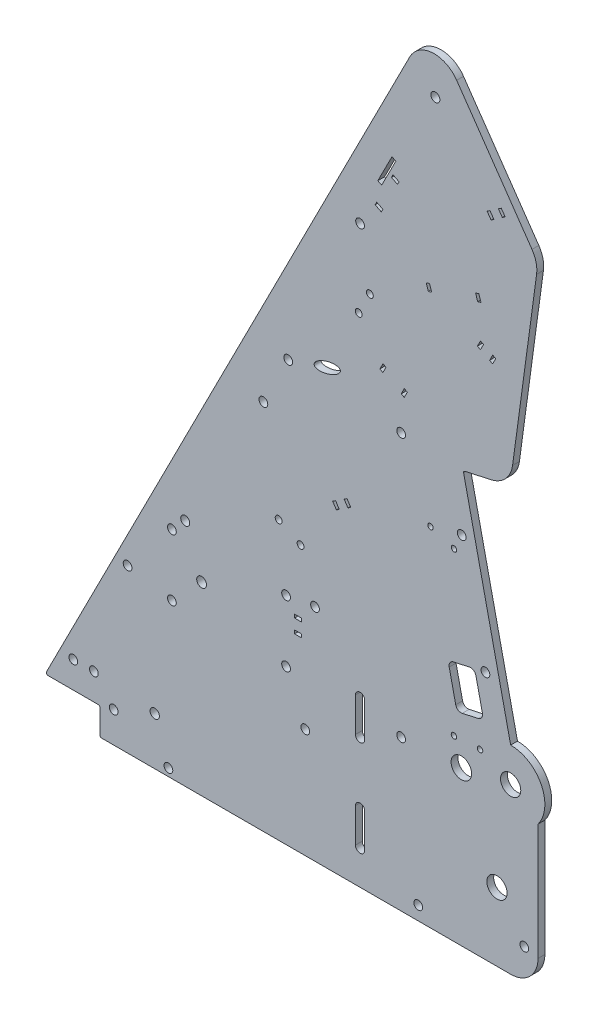
from build123d import *

# Parameters (mm, degrees)
BOSS_EXTRUDE1_DEPTH     = 3.175
SKETCH2_R               = 2.0955
SKETCH2_R_2             = 2.286
SKETCH2_R_3             = 2.032
SKETCH2_R_4             = 4.699
CUT_EXTRUDE1_DEPTH      = 421.976111717
SKETCH7_R               = 2.159
CUT_EXTRUDE2_DEPTH      = 421.976111717
CUT_EXTRUDE3_REACH      = 422.976
SKETCH10_R              = 2.032
FILLET1_R               = 12.7
FILLET2_R               = 0.79375
SKETCH12_R              = 2.032
CUT_EXTRUDE5_DEPTH      = 411.989226146
SKETCH13_R              = 2.032
SKETCH13_R_2            = 1.6
SKETCH13_RX             = 6.35
SKETCH13_RY             = 2.38125
SKETCH13_W              = 3.175
SKETCH13_H              = 1.5875
CUT_EXTRUDE6_DEPTH      = 411.989226146
CUT_EXTRUDE7_DEPTH      = 411.989226285
CUT_EXTRUDE7_DEPTH_BACK = 411.989226285
SKETCH14_R              = 1.27
SKETCH14_R_2            = 2.032
FILLET3_R               = 2.54
SKETCH15_R              = 4.7625
CUT_EXTRUDE8_DEPTH      = 411.989226285


with BuildPart() as part:
    # Sketch1 → Boss-Extrude1 (new body)
    with BuildSketch(Plane.XY):
        with BuildLine():
            Line((228.6, -12.7), (228.6, 53.975))
            ThreePointArc((228.6, 53.975), (230.099031657, 70.599515829), (215.9, 79.375))
            Line((215.9, 79.375), (193.909735224, 178.566674323))
            Line((193.909735224, 178.566674323), (215.607913982, 183.377044743))
            Line((215.607913982, 183.377044743), (228.6, 279.4))
            Line((228.6, 279.4), (178.754725958, 351.413083686))
            Line((178.754725958, 351.413083686), (0, 0))
            Line((0, 0), (25.4, 0))
            Line((25.4, 0), (25.4, -12.7))
            Line((25.4, -12.7), (228.6, -12.7))
        make_face()
    extrude(amount=BOSS_EXTRUDE1_DEPTH)

    # Sketch2 → Cut-Extrude1 (cut, through all)
    with BuildSketch(Plane.XY.offset(3.175)):
        with Locations((64.943150167, 94.057839899)):
            Circle(SKETCH2_R)
        with Locations((180.975, 322.164313376)):
            Circle(SKETCH2_R)
        with Locations((72.544547852, 73.173171402)):
            Circle(SKETCH2_R_2)
        with Locations((193.207821773, 152.394364194)):
            Circle(SKETCH2_R_3)
        with Locations((215.9, 63.5)):
            Circle(SKETCH2_R_4)
        with Locations((173.0375, -6.35)):
            Circle(SKETCH2_R_3)
        with Locations((204.202954161, 102.798527032)):
            Circle(SKETCH2_R_3)
        with Locations((209.55, 19.05)):
            Circle(SKETCH2_R_4)
        with Locations((165.1, 179.3875)):
            Circle(SKETCH2_R_3)
        with Locations((111.724047852, 87.460671402)):
            Circle(SKETCH2_R_3)
        with Locations((111.724047852, 58.885671402)):
            Circle(SKETCH2_R_3)
        with Locations((58.765047852, 58.885671402)):
            Circle(SKETCH2_R_3)
        with Locations((58.765047852, 87.460671402)):
            Circle(SKETCH2_R_3)
    extrude(amount=-CUT_EXTRUDE1_DEPTH, mode=Mode.SUBTRACT)

    # Sketch7 → Cut-Extrude2 (cut, through all)
    with BuildSketch(Plane.XY.offset(3.175)):
        with Locations((50.8, 9.525)):
            Circle(SKETCH7_R)
        with BuildLine():
            Line((143.891, 3.175), (143.891, 19.05))
            ThreePointArc((143.891, 19.05), (146.05, 21.209), (148.209, 19.05))
            Line((148.209, 19.05), (148.209, 3.175))
            ThreePointArc((148.209, 3.175), (146.05, 1.016), (143.891, 3.175))
        make_face()
        with BuildLine():
            Line((143.891, 47.625), (143.891, 63.5))
            ThreePointArc((143.891, 63.5), (146.05, 65.659), (148.209, 63.5))
            Line((148.209, 63.5), (148.209, 47.625))
            ThreePointArc((148.209, 47.625), (146.05, 45.466), (143.891, 47.625))
        make_face()
    extrude(amount=-CUT_EXTRUDE2_DEPTH, mode=Mode.SUBTRACT)

    # Sketch10 → Cut-Extrude3 (cut, up to next)
    with BuildSketch(Plane.XY.offset(3.175), mode=Mode.PRIVATE) as cut_extrude3_sk1:
        with Locations((120.65, 38.1)):
            Circle(SKETCH10_R)
    cut_extrude3_tool1 = extrude(cut_extrude3_sk1.sketch, amount=-CUT_EXTRUDE3_REACH, mode=Mode.PRIVATE) & part.part
    # Sketch10 → Cut-Extrude3 (cut, up to next)
    with BuildSketch(Plane.XY.offset(3.175), mode=Mode.PRIVATE) as cut_extrude3_sk2:
        with Locations((165.1, 57.15)):
            Circle(SKETCH10_R)
    cut_extrude3_tool2 = extrude(cut_extrude3_sk2.sketch, amount=-CUT_EXTRUDE3_REACH, mode=Mode.PRIVATE) & part.part
    # Sketch10 → Cut-Extrude3 (cut, up to next)
    with BuildSketch(Plane.XY.offset(3.175), mode=Mode.PRIVATE) as cut_extrude3_sk3:
        with Locations((13.046467246, 12.334704411)):
            Circle(SKETCH10_R)
    cut_extrude3_tool3 = extrude(cut_extrude3_sk3.sketch, amount=-CUT_EXTRUDE3_REACH, mode=Mode.PRIVATE) & part.part
    # Sketch10 → Cut-Extrude3 (cut, up to next)
    with BuildSketch(Plane.XY.offset(3.175), mode=Mode.PRIVATE) as cut_extrude3_sk4:
        with Locations((22.571467246, 12.334704411)):
            Circle(SKETCH10_R)
    cut_extrude3_tool4 = extrude(cut_extrude3_sk4.sketch, amount=-CUT_EXTRUDE3_REACH, mode=Mode.PRIVATE) & part.part
    # Sketch10 → Cut-Extrude3 (cut, up to next)
    with BuildSketch(Plane.XY.offset(3.175), mode=Mode.PRIVATE) as cut_extrude3_sk5:
        with Locations((38.211447917, 62.639810909)):
            Circle(SKETCH10_R)
    cut_extrude3_tool5 = extrude(cut_extrude3_sk5.sketch, amount=-CUT_EXTRUDE3_REACH, mode=Mode.PRIVATE) & part.part
    add(cut_extrude3_tool1.solids().sort_by_distance((120.65, 38.1, 3.175))[0], mode=Mode.SUBTRACT)
    add(cut_extrude3_tool2.solids().sort_by_distance((165.1, 57.15, 3.175))[0], mode=Mode.SUBTRACT)
    add(cut_extrude3_tool3.solids().sort_by_distance((13.046467, 12.334704, 3.175))[0], mode=Mode.SUBTRACT)
    add(cut_extrude3_tool4.solids().sort_by_distance((22.571467, 12.334704, 3.175))[0], mode=Mode.SUBTRACT)
    add(cut_extrude3_tool5.solids().sort_by_distance((38.211448, 62.639811, 3.175))[0], mode=Mode.SUBTRACT)

    # Fillet1
    fillet1_edges = [part.edges().sort_by_distance(p)[0] for p in [
        (228.6, -12.7, 1.5875),
        (178.754725958, 351.413083686, 1.5875),
        (215.607913982, 183.377044743, 1.5875),
        (228.6, 279.4, 1.5875),
    ]]
    fillet(fillet1_edges, radius=FILLET1_R)

    # Fillet2
    fillet2_edges = [part.edges().sort_by_distance(p)[0] for p in [
        (25.4, -12.7, 1.5875),
        (25.4, 0, 1.5875),
        (193.909735224, 178.566674323, 1.5875),
        (0, 0, 1.5875),
    ]]
    fillet(fillet2_edges, radius=FILLET2_R)

    # Sketch12 → Cut-Extrude5 (cut, through all)
    with BuildSketch(Plane.XY.offset(3.175)):
        with Locations((31.75, 1.5875)):
            Circle(SKETCH12_R)
        with Locations((173.0375, -6.35)):
            Circle(SKETCH12_R)
        with Locations((222.25, 1.5875)):
            Circle(SKETCH12_R)
        with Locations((57.15, -9.2075)):
            Circle(SKETCH12_R)
    extrude(amount=-CUT_EXTRUDE5_DEPTH, mode=Mode.SUBTRACT)

    # Sketch13 → Cut-Extrude6 (cut, through all)
    with BuildSketch(Plane.XY.offset(3.175)):
        with Locations((112.7125, 182.5625)):
            Circle(SKETCH13_R)
        with Locations((146.05, 254)):
            Circle(SKETCH13_R)
        with Locations((101.196445848, 159.923142748)):
            Circle(SKETCH13_R)
        with Locations((145.425401324, 217.737567137)):
            Circle(SKETCH13_R_2)
        with Locations((150.594024053, 227.898538502)):
            Circle(SKETCH13_R_2)
        with Locations((108.294003262, 116.150198589)):
            Circle(SKETCH13_R_2)
        with Locations((118.454974627, 110.981575859)):
            Circle(SKETCH13_R_2)
        with Locations(Location((130.826142263, 188.461522288), (0, 0, 18.038739462))):
            Ellipse(SKETCH13_RX, SKETCH13_RY)
        Polygon((178.26972852, 245.992253978), (176.758236028, 245.506922447), (177.728899089, 242.483937462), (179.240391581, 242.969268992), align=None)
        Polygon((160.847712251, 288.198438198), (154.283561384, 275.294004564), (156.066187939, 274.387228647), (162.630338806, 287.29166228), align=None)
        Polygon((200.609634347, 249.830809719), (202.12112684, 250.316141249), (201.150463779, 253.339126235), (199.638971286, 252.853794704), align=None)
        Polygon((160.590482388, 279.78010172), (163.420402045, 278.340594951), (164.140155429, 279.75555478), (161.310235773, 281.195061549), align=None)
        Polygon((153.789663007, 266.410402556), (153.069909623, 264.995442728), (155.899829279, 263.555935959), (156.619582664, 264.970895787), align=None)
        Polygon((203.330342332, 234.029927366), (201.915382504, 234.74968075), (200.475875735, 231.919761094), (201.890835563, 231.200007709), align=None)
        Polygon((206.135715047, 229.040747556), (207.550674876, 228.320994171), (208.990181645, 231.150913828), (207.575221816, 231.870667212), align=None)
        Polygon((211.540543439, 292.889033628), (210.235229039, 291.98553456), (212.042227175, 289.374905759), (213.347541575, 290.278404827), align=None)
        Polygon((206.319285837, 289.275037356), (205.013971437, 288.371538288), (206.820969573, 285.760909487), (208.126283974, 286.664408555), align=None)
        Polygon((133.35043444, 136.102010662), (135.081463368, 133.440401403), (136.412267998, 134.305915867), (134.681239069, 136.967525126), align=None)
        Polygon((155.228084113, 200.119678264), (156.643043941, 199.39992488), (158.08255071, 202.229844536), (156.667590882, 202.949597921), align=None)
        Polygon((165.132802911, 195.081404573), (166.547762739, 194.361651188), (167.987269508, 197.191570845), (166.57230968, 197.911324229), align=None)
        Polygon((140.404681887, 136.90245926), (138.673652958, 139.564068519), (140.004457588, 140.429582984), (141.735486516, 137.767973724), align=None)
        with Locations((117.248547852, 81.078921402)):
            Rectangle(SKETCH13_W, SKETCH13_H)
        with Locations((117.248547852, 74.728921402)):
            Rectangle(SKETCH13_W, SKETCH13_H)
    extrude(amount=-CUT_EXTRUDE6_DEPTH, mode=Mode.SUBTRACT)

    # Sketch14 → Cut-Extrude7 (cut, two sides: drawn at the far end of the back side and taken through both)
    with BuildSketch(Plane.XY.offset(3.175).offset(-CUT_EXTRUDE7_DEPTH_BACK)):
        with Locations((189.602197334, 69.980636704)):
            Circle(SKETCH14_R)
        with Locations((201.708862449, 70.509225118)):
            Circle(SKETCH14_R)
        with Locations((165.1, 57.15)):
            Circle(SKETCH14_R_2)
        with Locations((125.14977438, 89.522927623)):
            Circle(SKETCH14_R_2)
        with Locations((178.721644858, 148.532438598)):
            Circle(SKETCH14_R)
        with Locations((189.622629605, 145.09537131)):
            Circle(SKETCH14_R)
        Polygon((186.844411154, 98.950230697), (199.243370445, 101.699013794), (203.36654509, 83.100574858), (190.9675858, 80.351791761), align=None)
    extrude(amount=CUT_EXTRUDE7_DEPTH + CUT_EXTRUDE7_DEPTH_BACK, mode=Mode.SUBTRACT)

    # Fillet3
    fillet3_edges = [part.edges().sort_by_distance(p)[0] for p in [
        (199.243370445, 101.699013794, 1.5875),
        (186.844411154, 98.950230697, 1.5875),
        (190.9675858, 80.351791761, 1.5875),
        (203.36654509, 83.100574858, 1.5875),
    ]]
    fillet(fillet3_edges, radius=FILLET3_R)

    # Sketch15 → Cut-Extrude8 (cut, through all)
    with BuildSketch(Plane.XY.offset(3.175)):
        with Locations((193.04, 58.801)):
            Circle(SKETCH15_R)
    extrude(amount=-CUT_EXTRUDE8_DEPTH, mode=Mode.SUBTRACT)


solid = part.part
